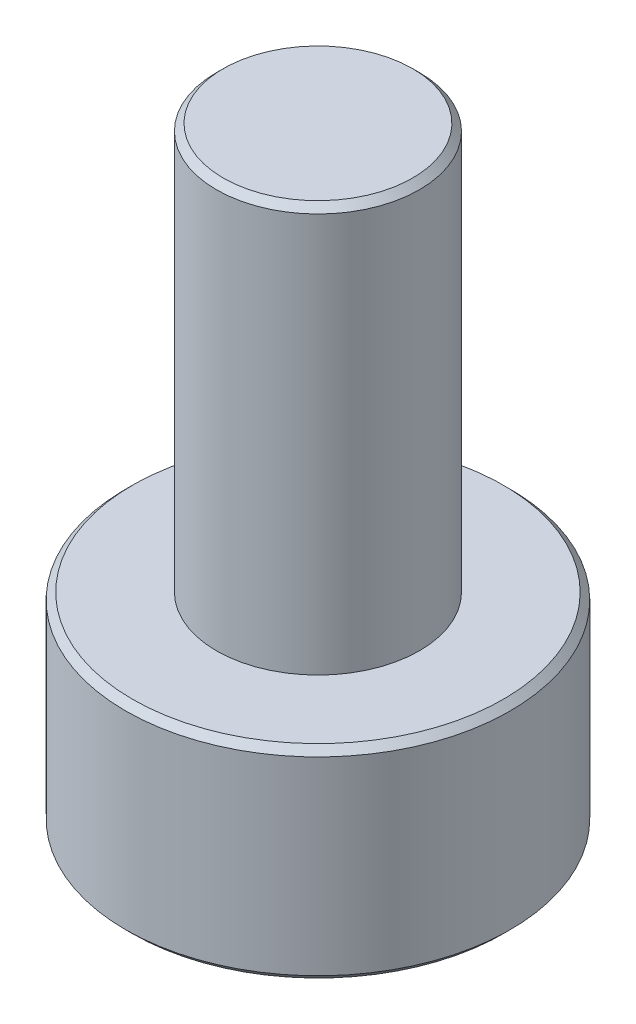
from build123d import *

# Parameters (mm, degrees)
SKETCH_1_R            = 2.84
EXTRUDE_261_DEPTH     = 3
SKETCH_2_R            = 1.5
EXTRUDE_346_DEPTH     = 6
CUT_EXTRUDE_531_DEPTH = 1.3
CHAMFER_593_SIZE      = 0.1


with BuildPart() as part:
    # 草图1 → Extrude 261 (new body)
    with BuildSketch(Plane(origin=(0, 0, 0), x_dir=(1, 0, 0), z_dir=(0, 1, 0))):
        Circle(SKETCH_1_R)
    extrude(amount=EXTRUDE_261_DEPTH)

    # 草图2 → Extrude 346 (add)
    with BuildSketch(Plane(origin=(0, 3, 0), x_dir=(1, 0, 0), z_dir=(0, 1, 0))):
        Circle(SKETCH_2_R)
    extrude(amount=EXTRUDE_346_DEPTH)

    # 草图3 → Cut-Extrude 531 (cut)
    with BuildSketch(Plane.XZ):
        Polygon((1.29, -0.744781847), (1.29, 0.744781847), (0, 1.489563695), (-1.29, 0.744781847), (-1.29, -0.744781847), (0, -1.489563695), align=None)
    extrude(amount=-CUT_EXTRUDE_531_DEPTH, mode=Mode.SUBTRACT)

    # Chamfer 593
    chamfer_593_edges = [part.edges().sort_by_distance(p)[0] for p in [
        (-1.5, 9, 0),
        (-2.84, 3, 0),
        (-2.84, 0, 0),
    ]]
    chamfer(chamfer_593_edges, length=CHAMFER_593_SIZE)


solid = part.part
